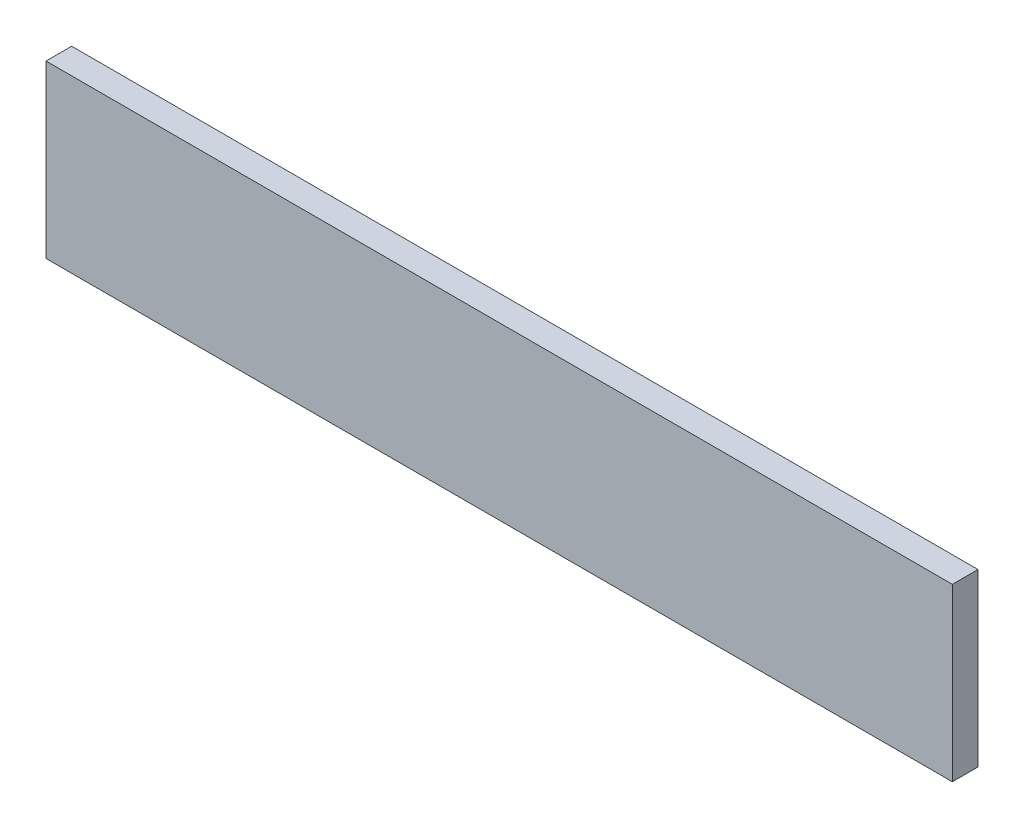
from build123d import *

# Parameters (mm, degrees)
IZIM1_W            = 530
IZIM1_H            = 100
TABAN_FLAN_1_DEPTH = 15


# Sheet-metal steps are written as plain solids
with BuildPart() as part:
    # Çizim1 → Taban-Flanş1 (new body)
    with BuildSketch(Plane.XY):
        with Locations((-265, -50)):
            Rectangle(IZIM1_W, IZIM1_H)
    extrude(amount=-TABAN_FLAN_1_DEPTH)


solid = part.part
